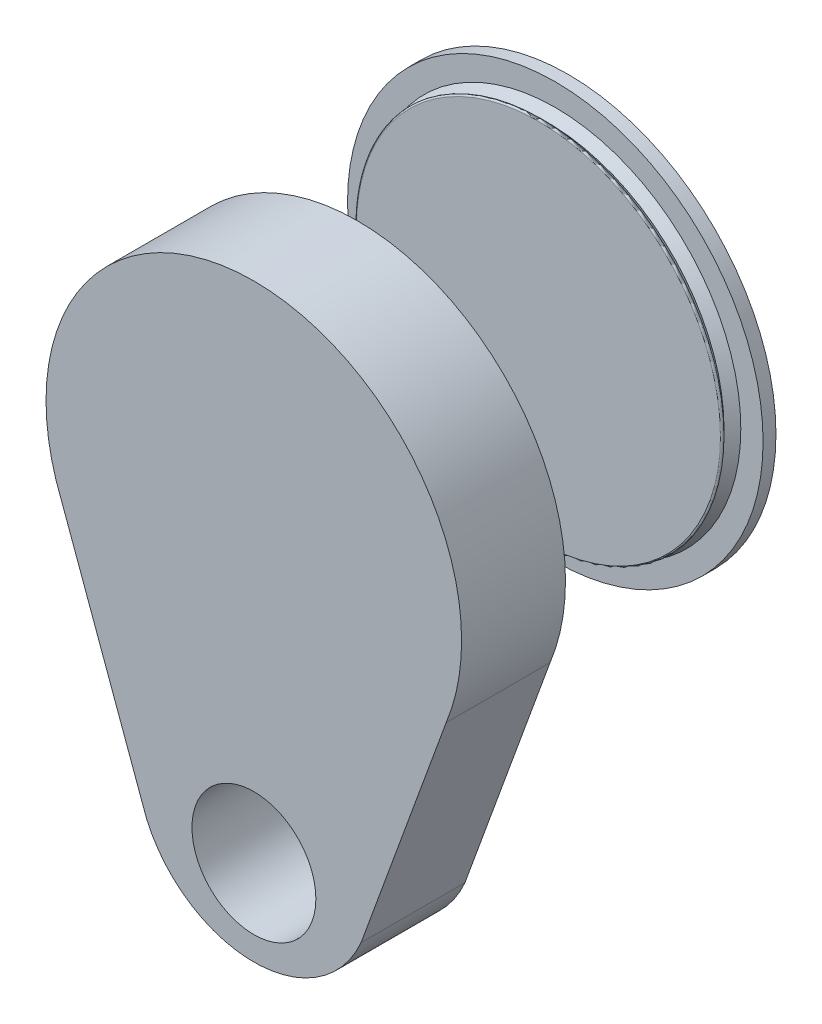
from build123d import *

# Parameters (mm, degrees)
BOSS_EXTRU_4_DEPTH      = 7
ESQUISSE11_R            = 4.175305872
ENL_V_MAT_EXTRU_2_DEPTH = 7
CONG_5_R                = 0.1


with BuildPart() as part:
    # Esquisse1 → Révolution1 (revolve)
    with BuildSketch(Plane(origin=(1.309044262, 0, 0), x_dir=(1, 0, 0), z_dir=(0, 1, 0))):
        Polygon((0.253488225, -3.046040946), (-13.746511775, -3.046040946), (-13.746511775, 3.953959054), (-12.746511775, 3.953959054), (-12.122011975, 3.453959054), (-12.746511775, 2.953959054), (-12.746511775, -2.046040946), (0.253488225, -2.046040946), align=None)
    revolve(axis=Axis((1.562532487, 0, 2.046040946), (0, 0, 1)))

    # Esquisse10 → Boss.-Extru.4 (add)
    with BuildSketch(Plane.XY.offset(3.046040946)):
        with BuildLine():
            Line((14.88883966, -4.290633652), (8.788835843, -21))
            ThreePointArc((8.788835843, -21), (1.562532487, -25.748246952), (-5.663770869, -21))
            Line((-5.663770869, -21), (-11.763774686, -4.290633652))
            ThreePointArc((-11.763774686, -4.290633652), (1.562532487, -13.260227708), (14.88883966, -4.290633652))
        make_face()
    extrude(amount=-BOSS_EXTRU_4_DEPTH)

    # Esquisse11 → Enlèv. mat.-Extru.2 (cut)
    with BuildSketch(Plane.XY.offset(3.046040946)):
        with Locations((1.568835843, -19.970784203)):
            Circle(ESQUISSE11_R)
    extrude(amount=-ENL_V_MAT_EXTRU_2_DEPTH, mode=Mode.SUBTRACT)


with BuildPart() as body_2:
    # Esquisse2 → Révolution2 (revolve)
    with BuildSketch(Plane(origin=(0, 0, -11.80070304), x_dir=(1, 0, 0), z_dir=(0, 1, 0))):
        Polygon((0.097906531, 5.799798736), (-12.402093469, 5.799798736), (-11.836408044, 6.365484161), (-12.402093469, 6.931169586), (-13.902093469, 6.931169586), (-13.902093469, 7.799798736), (0.097906531, 7.799798736), align=None)
    revolve(axis=Axis((0.097906531, 0, -19.600501776), (0, 0, 1)))

    # Congé5
    cong_5_edges = [body_2.edges().sort_by_distance(p)[0] for p in [
        (12.597906531, 0, -17.600501776),
    ]]
    fillet(cong_5_edges, radius=CONG_5_R)


solid = Compound([part.part, body_2.part])
